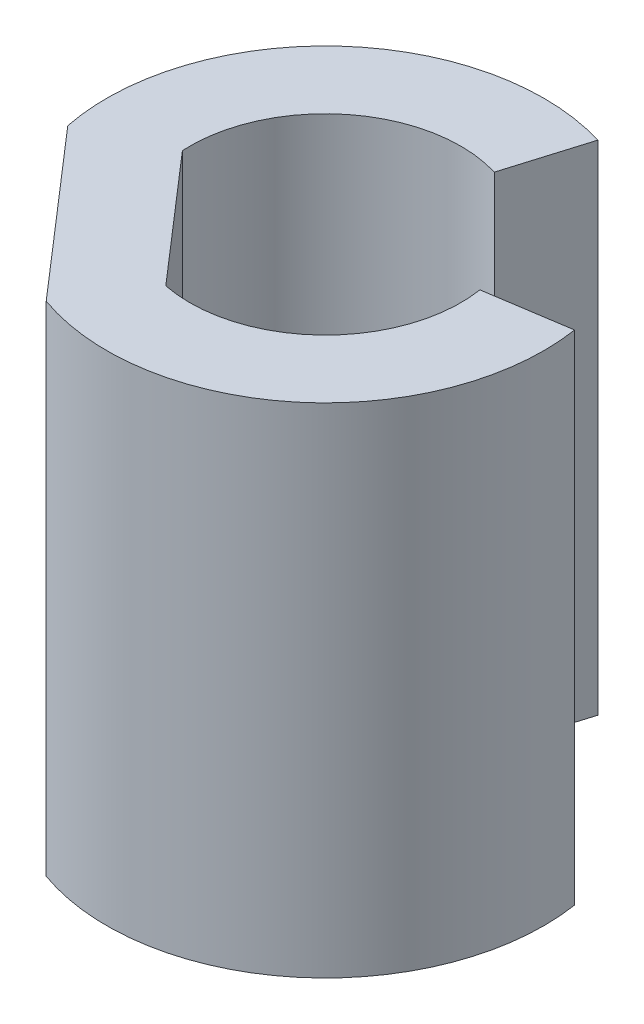
from build123d import *

# Parameters (mm, degrees)
BOSS_EXTRUDE1_DEPTH = 9


with BuildPart() as part:
    # Sketch1 → Boss-Extrude1 (new body)
    with BuildSketch(Plane(origin=(0, 0, 0), x_dir=(1, 0, 0), z_dir=(0, 1, 0))):
        with BuildLine():
            Line((-0.480336697, -2.402452218), (-2.446204679, -0.136318268))
            ThreePointArc((-2.446204679, -0.136318268), (-1.51475075, 1.925624617), (0.708554004, 2.345304079))
            Line((0.708554004, 2.345304079), (1.142362578, 3.781204536))
            ThreePointArc((1.142362578, 3.781204536), (-2.658617901, 2.921344016), (-3.871812311, -0.782029047))
            Line((-3.871812311, -0.782029047), (-1.320863014, -3.722609421))
            ThreePointArc((-1.320863014, -3.722609421), (2.517902784, -3.043462759), (3.904146056, 0.600119631))
            Line((3.904146056, 0.600119631), (2.421558946, 0.3722261))
            ThreePointArc((2.421558946, 0.3722261), (1.69316151, -1.770791942), (-0.480336697, -2.402452218))
        make_face()
    extrude(amount=BOSS_EXTRUDE1_DEPTH)


solid = part.part
